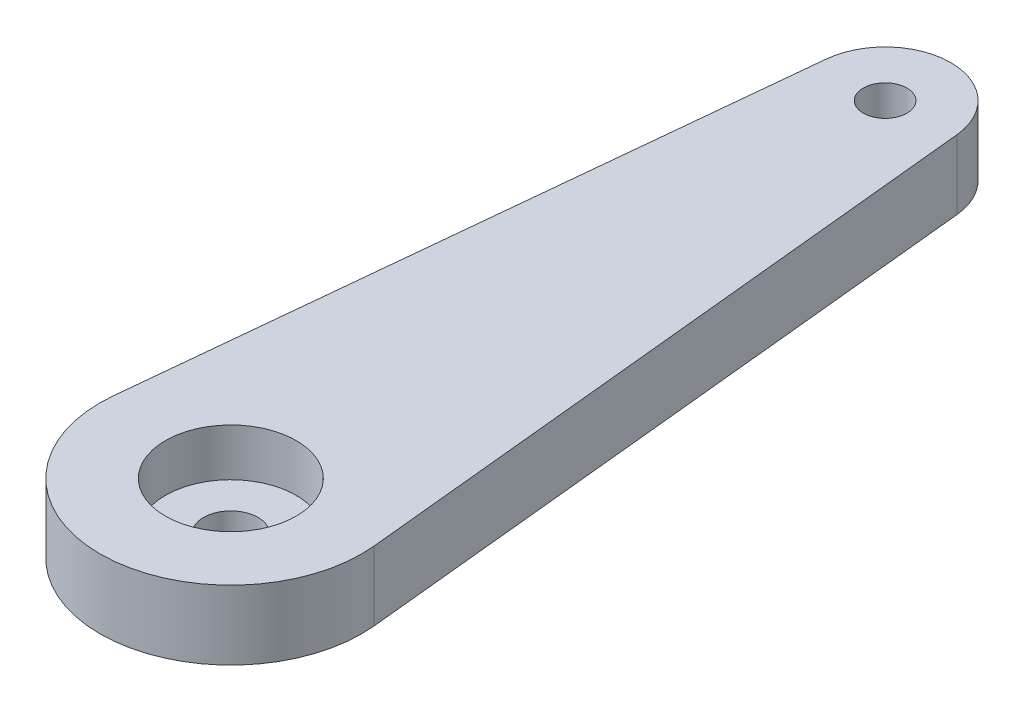
from build123d import *

# Parameters (mm, degrees)
SKETCH2_R           = 3
SKETCH2_R_2         = 1
BOSS_EXTRUDE1_DEPTH = 3.175
SKETCH2_4_R         = 3
SKETCH2_4_R_2       = 1.25
BOSS_EXTRUDE2_DEPTH = 1


with BuildPart() as part:
    # Sketch2 → Boss-Extrude1 (new body)
    with BuildSketch(Plane(origin=(0, 0, 0), x_dir=(1, 0, 0), z_dir=(0, 1, 0))):
        with BuildLine():
            ThreePointArc((3, 30.299992538), (0, 33.014961944), (-3, 30.299992538))
            Line((-3, 30.299992538), (-5.970224612, 0.597007611))
            ThreePointArc((-5.970224612, 0.597007611), (0, -6), (5.970224612, 0.597007611))
            Line((5.970224612, 0.597007611), (3, 30.299992538))
        make_face()
        Circle(SKETCH2_R, mode=Mode.SUBTRACT)
        with Locations((0, 30)):
            Circle(SKETCH2_R_2, mode=Mode.SUBTRACT)
    extrude(amount=BOSS_EXTRUDE1_DEPTH)

    # Sketch2<4> → Boss-Extrude2 (add)
    with BuildSketch(Plane(origin=(0, 0, 0), x_dir=(1, 0, 0), z_dir=(0, 1, 0))):
        Circle(SKETCH2_4_R)
        Circle(SKETCH2_4_R_2, mode=Mode.SUBTRACT)
    extrude(amount=BOSS_EXTRUDE2_DEPTH)


solid = part.part
